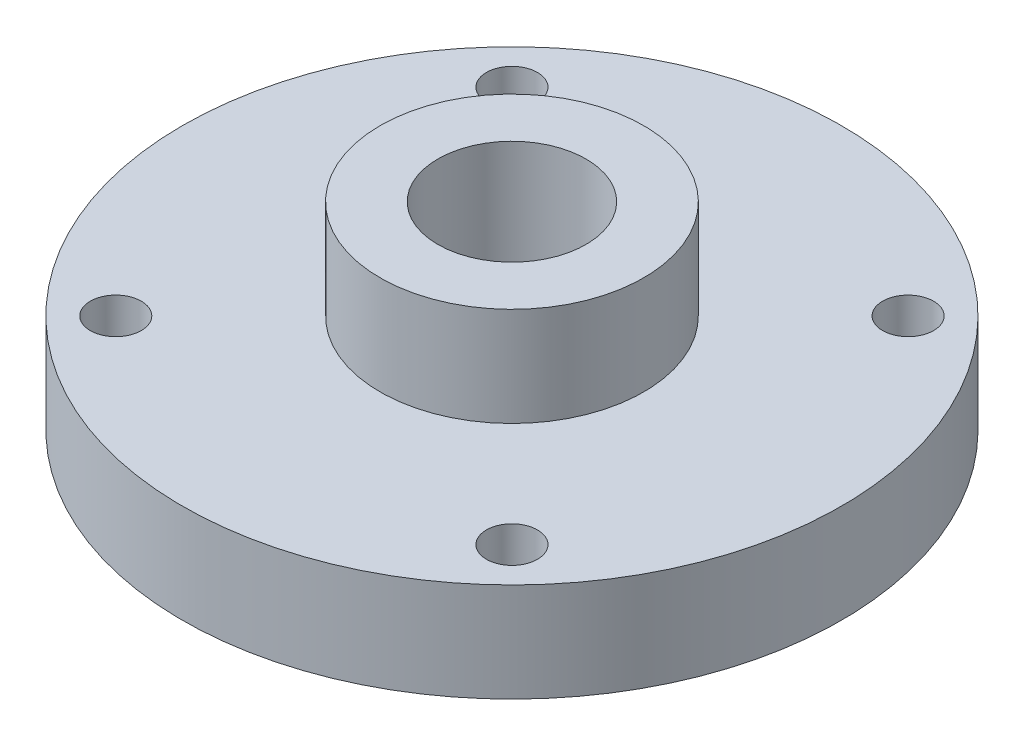
from build123d import *

# Parameters (mm, degrees)
F_10_0_1935_DIAMETER_HOLE1_D  = 4.9149
PIPE_TAP_DRILL_FOR_3_8_TAP1_D = 14.2748


with BuildPart() as part:
    # Sketch1 → Revolve1 (revolve)
    with BuildSketch(Plane.XY):
        Polygon((-12.7, -15.875), (-12.7, -19.05), (-19.0373, -19.05), (-19.0373, -15.9131), (-23.8125, -15.9131), (-23.8125, -19.05), (-31.75, -19.05), (-31.75, -9.525), (-12.7, -9.525), (-12.7, 0), (0, 0), (0, -15.875), align=None)
    revolve(axis=Axis((0, 0, 0), (0, -1, 0)))

    # #10 (0.1935) Diameter Hole1 (through all)
    with Locations(Plane(origin=(0, 0, 0), x_dir=(1, 0, 0), z_dir=(0, 1, 0))):
        with Locations((19.083044257, 19.083044257), (-19.083044257, 19.083044257), (-19.083044257, -19.083044257), (19.083044257, -19.083044257)):
            Hole(F_10_0_1935_DIAMETER_HOLE1_D / 2)

    # Pipe Tap Drill for 3/8 Tap1 (through all)
    with Locations(Plane(origin=(0, 0, 0), x_dir=(1, 0, 0), z_dir=(0, 1, 0))):
        with Locations((0, 0)):
            Hole(PIPE_TAP_DRILL_FOR_3_8_TAP1_D / 2)


solid = part.part
